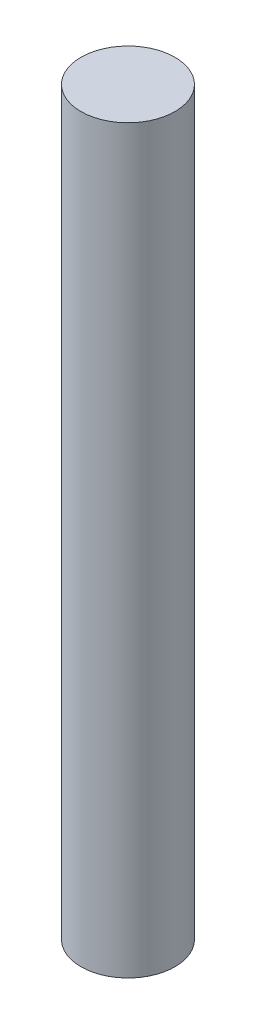
from build123d import *

# Parameters (mm, degrees)
SKETCH1_R           = 3.175
BOSS_EXTRUDE1_DEPTH = 50


with BuildPart() as part:
    # Sketch1 → Boss-Extrude1 (new body)
    with BuildSketch(Plane(origin=(0, 0, 0), x_dir=(1, 0, 0), z_dir=(0, 1, 0))):
        Circle(SKETCH1_R)
    extrude(amount=BOSS_EXTRUDE1_DEPTH)


solid = part.part
